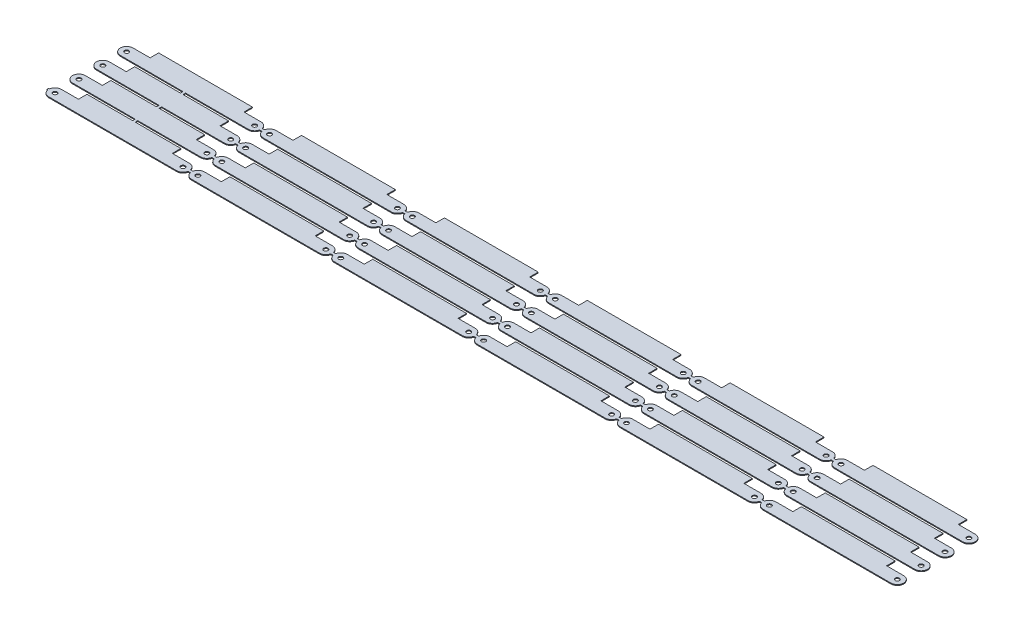
from build123d import *

# Parameters (mm, degrees)
SKETCH1_R           = 2.5
BOSS_EXTRUDE1_DEPTH = 1


with BuildPart() as part:
    # Sketch1 → Boss-Extrude1 (new body)
    with BuildSketch(Plane(origin=(0, 0, 0), x_dir=(1, 0, 0), z_dir=(0, 1, 0))):
        with BuildLine():
            Line((20, 7.5), (0, 7.5))
            ThreePointArc((0, 7.5), (-4.937104415, 5.645794895), (-7.433034374, 1))
            Line((-7.433034374, 1), (-8.433034374, 1))
            Line((-8.433034374, 1), (-8.433034374, -1))
            Line((-8.433034374, -1), (-7.433034374, -1))
            ThreePointArc((-7.433034374, -1), (-4.937104415, -5.645794895), (0, -7.5))
            Line((0, -7.5), (150, -7.5))
            ThreePointArc((150, -7.5), (154.74341649, -5.809475019), (157.348469228, -1.5))
            Line((157.348469228, -1.5), (160.151530772, -1.5))
            ThreePointArc((160.151530772, -1.5), (162.75658351, -5.809475019), (167.5, -7.5))
            Line((167.5, -7.5), (317.5, -7.5))
            ThreePointArc((317.5, -7.5), (322.24341649, -5.809475019), (324.848469228, -1.5))
            Line((324.848469228, -1.5), (327.651530772, -1.5))
            ThreePointArc((327.651530772, -1.5), (330.25658351, -5.809475019), (335, -7.5))
            Line((335, -7.5), (485, -7.5))
            ThreePointArc((485, -7.5), (489.74341649, -5.809475019), (492.348469228, -1.5))
            Line((492.348469228, -1.5), (495.151530772, -1.5))
            ThreePointArc((495.151530772, -1.5), (497.75658351, -5.809475019), (502.5, -7.5))
            Line((502.5, -7.5), (652.5, -7.5))
            ThreePointArc((652.5, -7.5), (657.24341649, -5.809475019), (659.848469228, -1.5))
            Line((659.848469228, -1.5), (662.651530772, -1.5))
            ThreePointArc((662.651530772, -1.5), (665.25658351, -5.809475019), (670, -7.5))
            Line((670, -7.5), (820, -7.5))
            ThreePointArc((820, -7.5), (824.74341649, -5.809475019), (827.348469228, -1.5))
            Line((827.348469228, -1.5), (830.151530772, -1.5))
            ThreePointArc((830.151530772, -1.5), (832.75658351, -5.809475019), (837.5, -7.5))
            Line((837.5, -7.5), (987.5, -7.5))
            ThreePointArc((987.5, -7.5), (995, 0), (987.5, 7.5))
            Line((987.5, 7.5), (967.5, 7.5))
            Line((967.5, 7.5), (967.5, 17.5))
            Line((967.5, 17.5), (857.5, 17.5))
            Line((857.5, 17.5), (857.5, 7.5))
            Line((857.5, 7.5), (837.5, 7.5))
            ThreePointArc((837.5, 7.5), (832.75658351, 5.809475019), (830.151530772, 1.5))
            Line((830.151530772, 1.5), (827.348469228, 1.5))
            ThreePointArc((827.348469228, 1.5), (824.74341649, 5.809475019), (820, 7.5))
            Line((820, 7.5), (800, 7.5))
            Line((800, 7.5), (800, 17.5))
            Line((800, 17.5), (690, 17.5))
            Line((690, 17.5), (690, 7.5))
            Line((690, 7.5), (670, 7.5))
            ThreePointArc((670, 7.5), (665.25658351, 5.809475019), (662.651530772, 1.5))
            Line((662.651530772, 1.5), (659.848469228, 1.5))
            ThreePointArc((659.848469228, 1.5), (657.24341649, 5.809475019), (652.5, 7.5))
            Line((652.5, 7.5), (632.5, 7.5))
            Line((632.5, 7.5), (632.5, 17.5))
            Line((632.5, 17.5), (522.5, 17.5))
            Line((522.5, 17.5), (522.5, 7.5))
            Line((522.5, 7.5), (502.5, 7.5))
            ThreePointArc((502.5, 7.5), (497.75658351, 5.809475019), (495.151530772, 1.5))
            Line((495.151530772, 1.5), (492.348469228, 1.5))
            ThreePointArc((492.348469228, 1.5), (489.74341649, 5.809475019), (485, 7.5))
            Line((485, 7.5), (465, 7.5))
            Line((465, 7.5), (465, 17.5))
            Line((465, 17.5), (355, 17.5))
            Line((355, 17.5), (355, 7.5))
            Line((355, 7.5), (335, 7.5))
            ThreePointArc((335, 7.5), (330.25658351, 5.809475019), (327.651530772, 1.5))
            Line((327.651530772, 1.5), (324.848469228, 1.5))
            ThreePointArc((324.848469228, 1.5), (322.24341649, 5.809475019), (317.5, 7.5))
            Line((317.5, 7.5), (297.5, 7.5))
            Line((297.5, 7.5), (297.5, 17.5))
            Line((297.5, 17.5), (187.5, 17.5))
            Line((187.5, 17.5), (187.5, 7.5))
            Line((187.5, 7.5), (167.5, 7.5))
            ThreePointArc((167.5, 7.5), (162.75658351, 5.809475019), (160.151530772, 1.5))
            Line((160.151530772, 1.5), (157.348469228, 1.5))
            ThreePointArc((157.348469228, 1.5), (154.74341649, 5.809475019), (150, 7.5))
            Line((150, 7.5), (130, 7.5))
            Line((130, 7.5), (130, 17.5))
            Line((130, 17.5), (76.5, 17.5))
            Line((76.5, 17.5), (76.5, 20.5))
            Line((76.5, 20.5), (150, 20.5))
            ThreePointArc((150, 20.5), (154.74341649, 22.190524981), (157.348469228, 26.5))
            Line((157.348469228, 26.5), (160.151530772, 26.5))
            ThreePointArc((160.151530772, 26.5), (162.75658351, 22.190524981), (167.5, 20.5))
            Line((167.5, 20.5), (317.5, 20.5))
            ThreePointArc((317.5, 20.5), (322.24341649, 22.190524981), (324.848469228, 26.5))
            Line((324.848469228, 26.5), (327.651530772, 26.5))
            ThreePointArc((327.651530772, 26.5), (330.25658351, 22.190524981), (335, 20.5))
            Line((335, 20.5), (485, 20.5))
            ThreePointArc((485, 20.5), (489.74341649, 22.190524981), (492.348469228, 26.5))
            Line((492.348469228, 26.5), (495.151530772, 26.5))
            ThreePointArc((495.151530772, 26.5), (497.75658351, 22.190524981), (502.5, 20.5))
            Line((502.5, 20.5), (652.5, 20.5))
            ThreePointArc((652.5, 20.5), (657.24341649, 22.190524981), (659.848469228, 26.5))
            Line((659.848469228, 26.5), (662.651530772, 26.5))
            ThreePointArc((662.651530772, 26.5), (665.25658351, 22.190524981), (670, 20.5))
            Line((670, 20.5), (820, 20.5))
            ThreePointArc((820, 20.5), (824.74341649, 22.190524981), (827.348469228, 26.5))
            Line((827.348469228, 26.5), (830.151530772, 26.5))
            ThreePointArc((830.151530772, 26.5), (832.75658351, 22.190524981), (837.5, 20.5))
            Line((837.5, 20.5), (987.5, 20.5))
            ThreePointArc((987.5, 20.5), (995, 28), (987.5, 35.5))
            Line((987.5, 35.5), (967.5, 35.5))
            Line((967.5, 35.5), (967.5, 45.5))
            Line((967.5, 45.5), (857.5, 45.5))
            Line((857.5, 45.5), (857.5, 35.5))
            Line((857.5, 35.5), (837.5, 35.5))
            ThreePointArc((837.5, 35.5), (832.75658351, 33.809475019), (830.151530772, 29.5))
            Line((830.151530772, 29.5), (827.348469228, 29.5))
            ThreePointArc((827.348469228, 29.5), (824.74341649, 33.809475019), (820, 35.5))
            Line((820, 35.5), (800, 35.5))
            Line((800, 35.5), (800, 45.5))
            Line((800, 45.5), (690, 45.5))
            Line((690, 45.5), (690, 35.5))
            Line((690, 35.5), (670, 35.5))
            ThreePointArc((670, 35.5), (665.25658351, 33.809475019), (662.651530772, 29.5))
            Line((662.651530772, 29.5), (659.848469228, 29.5))
            ThreePointArc((659.848469228, 29.5), (657.24341649, 33.809475019), (652.5, 35.5))
            Line((652.5, 35.5), (632.5, 35.5))
            Line((632.5, 35.5), (632.5, 45.5))
            Line((632.5, 45.5), (522.5, 45.5))
            Line((522.5, 45.5), (522.5, 35.5))
            Line((522.5, 35.5), (502.5, 35.5))
            ThreePointArc((502.5, 35.5), (497.75658351, 33.809475019), (495.151530772, 29.5))
            Line((495.151530772, 29.5), (492.348469228, 29.5))
            ThreePointArc((492.348469228, 29.5), (489.74341649, 33.809475019), (485, 35.5))
            Line((485, 35.5), (465, 35.5))
            Line((465, 35.5), (465, 45.5))
            Line((465, 45.5), (355, 45.5))
            Line((355, 45.5), (355, 35.5))
            Line((355, 35.5), (335, 35.5))
            ThreePointArc((335, 35.5), (330.25658351, 33.809475019), (327.651530772, 29.5))
            Line((327.651530772, 29.5), (324.848469228, 29.5))
            ThreePointArc((324.848469228, 29.5), (322.24341649, 33.809475019), (317.5, 35.5))
            Line((317.5, 35.5), (297.5, 35.5))
            Line((297.5, 35.5), (297.5, 45.5))
            Line((297.5, 45.5), (187.5, 45.5))
            Line((187.5, 45.5), (187.5, 35.5))
            Line((187.5, 35.5), (167.5, 35.5))
            ThreePointArc((167.5, 35.5), (162.75658351, 33.809475019), (160.151530772, 29.5))
            Line((160.151530772, 29.5), (157.348469228, 29.5))
            ThreePointArc((157.348469228, 29.5), (154.74341649, 33.809475019), (150, 35.5))
            Line((150, 35.5), (130, 35.5))
            Line((130, 35.5), (130, 45.5))
            Line((130, 45.5), (76.5, 45.5))
            Line((76.5, 45.5), (76.5, 48.5))
            Line((76.5, 48.5), (150, 48.5))
            ThreePointArc((150, 48.5), (154.74341649, 50.190524981), (157.348469228, 54.5))
            Line((157.348469228, 54.5), (160.151530772, 54.5))
            ThreePointArc((160.151530772, 54.5), (162.75658351, 50.190524981), (167.5, 48.5))
            Line((167.5, 48.5), (317.5, 48.5))
            ThreePointArc((317.5, 48.5), (322.24341649, 50.190524981), (324.848469228, 54.5))
            Line((324.848469228, 54.5), (327.651530772, 54.5))
            ThreePointArc((327.651530772, 54.5), (330.25658351, 50.190524981), (335, 48.5))
            Line((335, 48.5), (485, 48.5))
            ThreePointArc((485, 48.5), (489.74341649, 50.190524981), (492.348469228, 54.5))
            Line((492.348469228, 54.5), (495.151530772, 54.5))
            ThreePointArc((495.151530772, 54.5), (497.75658351, 50.190524981), (502.5, 48.5))
            Line((502.5, 48.5), (652.5, 48.5))
            ThreePointArc((652.5, 48.5), (657.24341649, 50.190524981), (659.848469228, 54.5))
            Line((659.848469228, 54.5), (662.651530772, 54.5))
            ThreePointArc((662.651530772, 54.5), (665.25658351, 50.190524981), (670, 48.5))
            Line((670, 48.5), (820, 48.5))
            ThreePointArc((820, 48.5), (824.74341649, 50.190524981), (827.348469228, 54.5))
            Line((827.348469228, 54.5), (830.151530772, 54.5))
            ThreePointArc((830.151530772, 54.5), (832.75658351, 50.190524981), (837.5, 48.5))
            Line((837.5, 48.5), (987.5, 48.5))
            ThreePointArc((987.5, 48.5), (995, 56), (987.5, 63.5))
            Line((987.5, 63.5), (967.5, 63.5))
            Line((967.5, 63.5), (967.5, 73.5))
            Line((967.5, 73.5), (857.5, 73.5))
            Line((857.5, 73.5), (857.5, 63.5))
            Line((857.5, 63.5), (837.5, 63.5))
            ThreePointArc((837.5, 63.5), (832.75658351, 61.809475019), (830.151530772, 57.5))
            Line((830.151530772, 57.5), (827.348469228, 57.5))
            ThreePointArc((827.348469228, 57.5), (824.74341649, 61.809475019), (820, 63.5))
            Line((820, 63.5), (800, 63.5))
            Line((800, 63.5), (800, 73.5))
            Line((800, 73.5), (690, 73.5))
            Line((690, 73.5), (690, 63.5))
            Line((690, 63.5), (670, 63.5))
            ThreePointArc((670, 63.5), (665.25658351, 61.809475019), (662.651530772, 57.5))
            Line((662.651530772, 57.5), (659.848469228, 57.5))
            ThreePointArc((659.848469228, 57.5), (657.24341649, 61.809475019), (652.5, 63.5))
            Line((652.5, 63.5), (632.5, 63.5))
            Line((632.5, 63.5), (632.5, 73.5))
            Line((632.5, 73.5), (522.5, 73.5))
            Line((522.5, 73.5), (522.5, 63.5))
            Line((522.5, 63.5), (502.5, 63.5))
            ThreePointArc((502.5, 63.5), (497.75658351, 61.809475019), (495.151530772, 57.5))
            Line((495.151530772, 57.5), (492.348469228, 57.5))
            ThreePointArc((492.348469228, 57.5), (489.74341649, 61.809475019), (485, 63.5))
            Line((485, 63.5), (465, 63.5))
            Line((465, 63.5), (465, 73.5))
            Line((465, 73.5), (355, 73.5))
            Line((355, 73.5), (355, 63.5))
            Line((355, 63.5), (335, 63.5))
            ThreePointArc((335, 63.5), (330.25658351, 61.809475019), (327.651530772, 57.5))
            Line((327.651530772, 57.5), (324.848469228, 57.5))
            ThreePointArc((324.848469228, 57.5), (322.24341649, 61.809475019), (317.5, 63.5))
            Line((317.5, 63.5), (297.5, 63.5))
            Line((297.5, 63.5), (297.5, 73.5))
            Line((297.5, 73.5), (187.5, 73.5))
            Line((187.5, 73.5), (187.5, 63.5))
            Line((187.5, 63.5), (167.5, 63.5))
            ThreePointArc((167.5, 63.5), (162.75658351, 61.809475019), (160.151530772, 57.5))
            Line((160.151530772, 57.5), (157.348469228, 57.5))
            ThreePointArc((157.348469228, 57.5), (154.74341649, 61.809475019), (150, 63.5))
            Line((150, 63.5), (130, 63.5))
            Line((130, 63.5), (130, 73.5))
            Line((130, 73.5), (76.5, 73.5))
            Line((76.5, 73.5), (76.5, 76.5))
            Line((76.5, 76.5), (150, 76.5))
            ThreePointArc((150, 76.5), (154.74341649, 78.190524981), (157.348469228, 82.5))
            Line((157.348469228, 82.5), (160.151530772, 82.5))
            ThreePointArc((160.151530772, 82.5), (162.75658351, 78.190524981), (167.5, 76.5))
            Line((167.5, 76.5), (317.5, 76.5))
            ThreePointArc((317.5, 76.5), (322.24341649, 78.190524981), (324.848469228, 82.5))
            Line((324.848469228, 82.5), (327.651530772, 82.5))
            ThreePointArc((327.651530772, 82.5), (330.25658351, 78.190524981), (335, 76.5))
            Line((335, 76.5), (485, 76.5))
            ThreePointArc((485, 76.5), (489.74341649, 78.190524981), (492.348469228, 82.5))
            Line((492.348469228, 82.5), (495.151530772, 82.5))
            ThreePointArc((495.151530772, 82.5), (497.75658351, 78.190524981), (502.5, 76.5))
            Line((502.5, 76.5), (652.5, 76.5))
            ThreePointArc((652.5, 76.5), (657.24341649, 78.190524981), (659.848469228, 82.5))
            Line((659.848469228, 82.5), (662.651530772, 82.5))
            ThreePointArc((662.651530772, 82.5), (665.25658351, 78.190524981), (670, 76.5))
            Line((670, 76.5), (820, 76.5))
            ThreePointArc((820, 76.5), (824.74341649, 78.190524981), (827.348469228, 82.5))
            Line((827.348469228, 82.5), (830.151530772, 82.5))
            ThreePointArc((830.151530772, 82.5), (832.75658351, 78.190524981), (837.5, 76.5))
            Line((837.5, 76.5), (987.5, 76.5))
            ThreePointArc((987.5, 76.5), (995, 84), (987.5, 91.5))
            Line((987.5, 91.5), (967.5, 91.5))
            Line((967.5, 91.5), (967.5, 101.5))
            Line((967.5, 101.5), (857.5, 101.5))
            Line((857.5, 101.5), (857.5, 91.5))
            Line((857.5, 91.5), (837.5, 91.5))
            ThreePointArc((837.5, 91.5), (832.75658351, 89.809475019), (830.151530772, 85.5))
            Line((830.151530772, 85.5), (827.348469228, 85.5))
            ThreePointArc((827.348469228, 85.5), (824.74341649, 89.809475019), (820, 91.5))
            Line((820, 91.5), (800, 91.5))
            Line((800, 91.5), (800, 101.5))
            Line((800, 101.5), (690, 101.5))
            Line((690, 101.5), (690, 91.5))
            Line((690, 91.5), (670, 91.5))
            ThreePointArc((670, 91.5), (665.25658351, 89.809475019), (662.651530772, 85.5))
            Line((662.651530772, 85.5), (659.848469228, 85.5))
            ThreePointArc((659.848469228, 85.5), (657.24341649, 89.809475019), (652.5, 91.5))
            Line((652.5, 91.5), (632.5, 91.5))
            Line((632.5, 91.5), (632.5, 101.5))
            Line((632.5, 101.5), (522.5, 101.5))
            Line((522.5, 101.5), (522.5, 91.5))
            Line((522.5, 91.5), (502.5, 91.5))
            ThreePointArc((502.5, 91.5), (497.75658351, 89.809475019), (495.151530772, 85.5))
            Line((495.151530772, 85.5), (492.348469228, 85.5))
            ThreePointArc((492.348469228, 85.5), (489.74341649, 89.809475019), (485, 91.5))
            Line((485, 91.5), (465, 91.5))
            Line((465, 91.5), (465, 101.5))
            Line((465, 101.5), (355, 101.5))
            Line((355, 101.5), (355, 91.5))
            Line((355, 91.5), (335, 91.5))
            ThreePointArc((335, 91.5), (330.25658351, 89.809475019), (327.651530772, 85.5))
            Line((327.651530772, 85.5), (324.848469228, 85.5))
            ThreePointArc((324.848469228, 85.5), (322.24341649, 89.809475019), (317.5, 91.5))
            Line((317.5, 91.5), (297.5, 91.5))
            Line((297.5, 91.5), (297.5, 101.5))
            Line((297.5, 101.5), (187.5, 101.5))
            Line((187.5, 101.5), (187.5, 91.5))
            Line((187.5, 91.5), (167.5, 91.5))
            ThreePointArc((167.5, 91.5), (162.75658351, 89.809475019), (160.151530772, 85.5))
            Line((160.151530772, 85.5), (157.348469228, 85.5))
            ThreePointArc((157.348469228, 85.5), (154.74341649, 89.809475019), (150, 91.5))
            Line((150, 91.5), (130, 91.5))
            Line((130, 91.5), (130, 101.5))
            Line((130, 101.5), (20, 101.5))
            Line((20, 101.5), (20, 91.5))
            Line((20, 91.5), (0, 91.5))
            ThreePointArc((0, 91.5), (-7.5, 84), (0, 76.5))
            Line((0, 76.5), (73.5, 76.5))
            Line((73.5, 76.5), (73.5, 73.5))
            Line((73.5, 73.5), (20, 73.5))
            Line((20, 73.5), (20, 63.5))
            Line((20, 63.5), (0, 63.5))
            ThreePointArc((0, 63.5), (-7.5, 56), (0, 48.5))
            Line((0, 48.5), (73.5, 48.5))
            Line((73.5, 48.5), (73.5, 45.5))
            Line((73.5, 45.5), (20, 45.5))
            Line((20, 45.5), (20, 35.5))
            Line((20, 35.5), (0, 35.5))
            ThreePointArc((0, 35.5), (-7.5, 28), (0, 20.5))
            Line((0, 20.5), (73.5, 20.5))
            Line((73.5, 20.5), (73.5, 17.5))
            Line((73.5, 17.5), (20, 17.5))
            Line((20, 17.5), (20, 7.5))
        make_face()
        Circle(SKETCH1_R, mode=Mode.SUBTRACT)
        with Locations((150, 0)):
            Circle(SKETCH1_R, mode=Mode.SUBTRACT)
        with Locations((150, 28)):
            Circle(SKETCH1_R, mode=Mode.SUBTRACT)
        with Locations((0, 28)):
            Circle(SKETCH1_R, mode=Mode.SUBTRACT)
        with Locations((317.5, 0)):
            Circle(SKETCH1_R, mode=Mode.SUBTRACT)
        with Locations((167.5, 0)):
            Circle(SKETCH1_R, mode=Mode.SUBTRACT)
        with Locations((150, 56)):
            Circle(SKETCH1_R, mode=Mode.SUBTRACT)
        with Locations((0, 56)):
            Circle(SKETCH1_R, mode=Mode.SUBTRACT)
        with Locations((317.5, 28)):
            Circle(SKETCH1_R, mode=Mode.SUBTRACT)
        with Locations((167.5, 28)):
            Circle(SKETCH1_R, mode=Mode.SUBTRACT)
        with Locations((150, 84)):
            Circle(SKETCH1_R, mode=Mode.SUBTRACT)
        with Locations((0, 84)):
            Circle(SKETCH1_R, mode=Mode.SUBTRACT)
        with Locations((485, 0)):
            Circle(SKETCH1_R, mode=Mode.SUBTRACT)
        with Locations((335, 0)):
            Circle(SKETCH1_R, mode=Mode.SUBTRACT)
        with Locations((317.5, 56)):
            Circle(SKETCH1_R, mode=Mode.SUBTRACT)
        with Locations((167.5, 56)):
            Circle(SKETCH1_R, mode=Mode.SUBTRACT)
        with Locations((485, 28)):
            Circle(SKETCH1_R, mode=Mode.SUBTRACT)
        with Locations((335, 28)):
            Circle(SKETCH1_R, mode=Mode.SUBTRACT)
        with Locations((317.5, 84)):
            Circle(SKETCH1_R, mode=Mode.SUBTRACT)
        with Locations((167.5, 84)):
            Circle(SKETCH1_R, mode=Mode.SUBTRACT)
        with Locations((652.5, 0)):
            Circle(SKETCH1_R, mode=Mode.SUBTRACT)
        with Locations((502.5, 0)):
            Circle(SKETCH1_R, mode=Mode.SUBTRACT)
        with Locations((485, 56)):
            Circle(SKETCH1_R, mode=Mode.SUBTRACT)
        with Locations((335, 56)):
            Circle(SKETCH1_R, mode=Mode.SUBTRACT)
        with Locations((652.5, 28)):
            Circle(SKETCH1_R, mode=Mode.SUBTRACT)
        with Locations((502.5, 28)):
            Circle(SKETCH1_R, mode=Mode.SUBTRACT)
        with Locations((485, 84)):
            Circle(SKETCH1_R, mode=Mode.SUBTRACT)
        with Locations((335, 84)):
            Circle(SKETCH1_R, mode=Mode.SUBTRACT)
        with Locations((820, 0)):
            Circle(SKETCH1_R, mode=Mode.SUBTRACT)
        with Locations((670, 0)):
            Circle(SKETCH1_R, mode=Mode.SUBTRACT)
        with Locations((652.5, 56)):
            Circle(SKETCH1_R, mode=Mode.SUBTRACT)
        with Locations((502.5, 56)):
            Circle(SKETCH1_R, mode=Mode.SUBTRACT)
        with Locations((820, 28)):
            Circle(SKETCH1_R, mode=Mode.SUBTRACT)
        with Locations((670, 28)):
            Circle(SKETCH1_R, mode=Mode.SUBTRACT)
        with Locations((652.5, 84)):
            Circle(SKETCH1_R, mode=Mode.SUBTRACT)
        with Locations((502.5, 84)):
            Circle(SKETCH1_R, mode=Mode.SUBTRACT)
        with Locations((987.5, 0)):
            Circle(SKETCH1_R, mode=Mode.SUBTRACT)
        with Locations((837.5, 0)):
            Circle(SKETCH1_R, mode=Mode.SUBTRACT)
        with Locations((820, 56)):
            Circle(SKETCH1_R, mode=Mode.SUBTRACT)
        with Locations((670, 56)):
            Circle(SKETCH1_R, mode=Mode.SUBTRACT)
        with Locations((987.5, 28)):
            Circle(SKETCH1_R, mode=Mode.SUBTRACT)
        with Locations((837.5, 28)):
            Circle(SKETCH1_R, mode=Mode.SUBTRACT)
        with Locations((820, 84)):
            Circle(SKETCH1_R, mode=Mode.SUBTRACT)
        with Locations((670, 84)):
            Circle(SKETCH1_R, mode=Mode.SUBTRACT)
        with Locations((987.5, 56)):
            Circle(SKETCH1_R, mode=Mode.SUBTRACT)
        with Locations((837.5, 56)):
            Circle(SKETCH1_R, mode=Mode.SUBTRACT)
        with Locations((987.5, 84)):
            Circle(SKETCH1_R, mode=Mode.SUBTRACT)
        with Locations((837.5, 84)):
            Circle(SKETCH1_R, mode=Mode.SUBTRACT)
    extrude(amount=BOSS_EXTRUDE1_DEPTH)


solid = part.part
